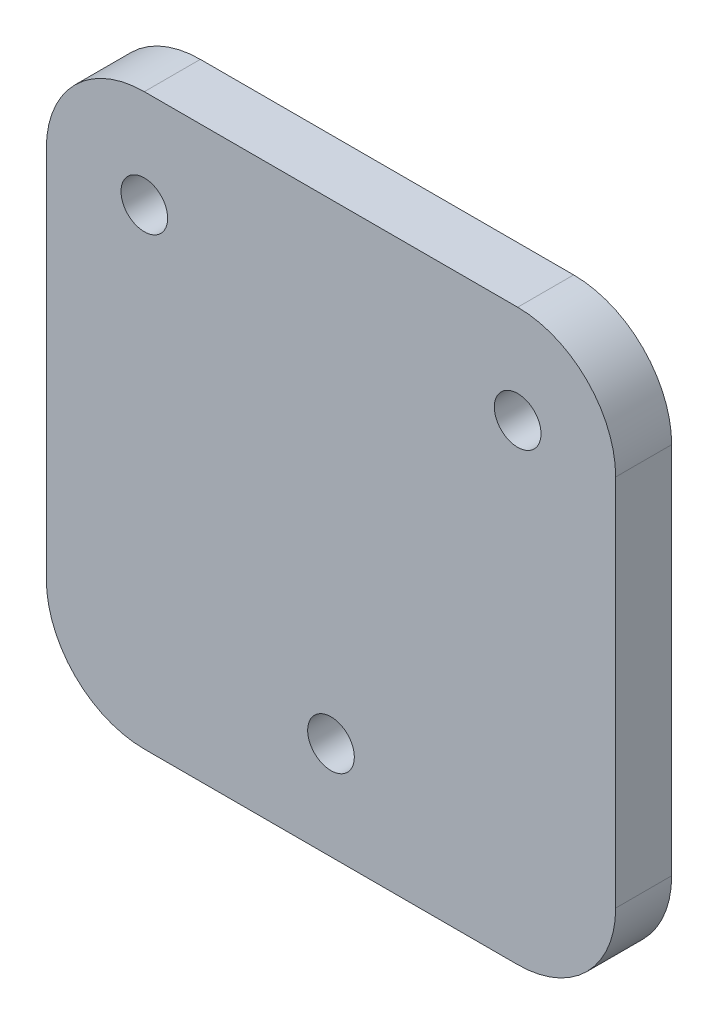
from build123d import *

# Parameters (mm, degrees)
ESBO_O1_R                = 2.5
RESSALTO_EXTRUS_O1_DEPTH = 6


with BuildPart() as part:
    # Esboço1 → Ressalto-extrusão1 (new body)
    with BuildSketch(Plane.XY):
        with BuildLine():
            Line((-20, 30.5), (20, 30.5))
            ThreePointArc((20, 30.5), (27.424621202, 27.424621202), (30.5, 20))
            Line((30.5, 20), (30.5, -20))
            ThreePointArc((30.5, -20), (27.424621202, -27.424621202), (20, -30.5))
            Line((20, -30.5), (-20, -30.5))
            ThreePointArc((-20, -30.5), (-27.424621202, -27.424621202), (-30.5, -20))
            Line((-30.5, -20), (-30.5, 20))
            ThreePointArc((-30.5, 20), (-27.424621202, 27.424621202), (-20, 30.5))
        make_face()
        with Locations((-20, 20)):
            Circle(ESBO_O1_R, mode=Mode.SUBTRACT)
        with Locations((20, 20)):
            Circle(ESBO_O1_R, mode=Mode.SUBTRACT)
        with Locations((0, -20)):
            Circle(ESBO_O1_R, mode=Mode.SUBTRACT)
    extrude(amount=RESSALTO_EXTRUS_O1_DEPTH)


solid = part.part
